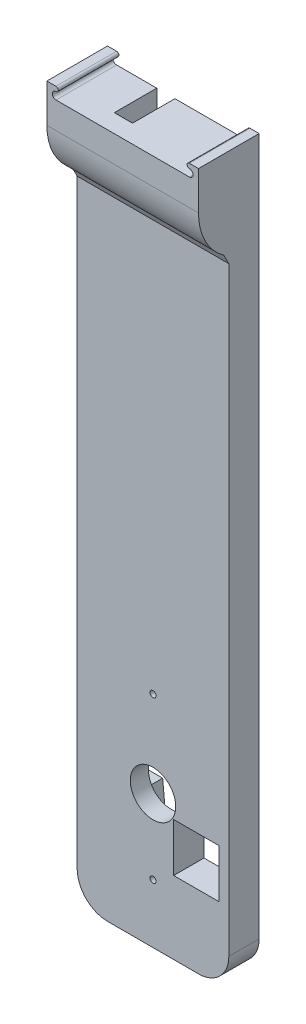
from build123d import *

# Parameters (mm, degrees)
SKICA1_W                 = 25
SKICA1_H                 = 120
P_IDAT_VYSUNUT_M1_DEPTH  = 5
SKICA2_W                 = 25
SKICA2_H                 = 15
P_IDAT_VYSUNUT_M2_DEPTH  = 10
ZAOBLIT5_R               = 5
ZAOBLIT6_R               = 5
ODEBRAT_VYSUNUT_M2_DEPTH = 20
ZAOBLIT7_R               = 10
SKICA4_W                 = 3
SKICA4_H                 = 7
ODEBRAT_VYSUNUT_M3_DEPTH = 4
ODEBRAT_VYSUNUT_M4_DEPTH = 2
ODEBRAT_START            = -3
SKICA7_R                 = 0.5
ODEBRAT_VYSUNUT_M5_DEPTH = 2.8
SKICA8_R                 = 3.75
ODEBRAT_VYSUNUT_M6_DEPTH = 123.837290755
SKICA9_W                 = 7.5
SKICA9_H                 = 8
ODEBRAT_VYSUNUT_M7_DEPTH = 123.983738762


with BuildPart() as part:
    # Skica1 → Přidat vysunutím1 (new body)
    with BuildSketch(Plane.XY):
        with Locations((12.5, 60)):
            Rectangle(SKICA1_W, SKICA1_H)
    extrude(amount=P_IDAT_VYSUNUT_M1_DEPTH)

    # Skica2 → Přidat vysunutím2 (add)
    with BuildSketch(Plane(origin=(0, 0, 0), x_dir=(-1, 0, 0), z_dir=(0, 0, -1))):
        with Locations((-12.5, 112.5)):
            Rectangle(SKICA2_W, SKICA2_H)
    extrude(amount=-P_IDAT_VYSUNUT_M2_DEPTH)

    # Zaoblit5
    zaoblit5_edges = [part.edges().sort_by_distance(p)[0] for p in [
        (25, 0, 2.5),
    ]]
    fillet(zaoblit5_edges, radius=ZAOBLIT5_R)

    # Zaoblit6
    zaoblit6_edges = [part.edges().sort_by_distance(p)[0] for p in [
        (0, 0, 2.5),
    ]]
    fillet(zaoblit6_edges, radius=ZAOBLIT6_R)

    # Skica3 → Odebrat vysunutím2 (cut)
    with BuildSketch(Plane.XY.offset(10)):
        with BuildLine():
            Line((1.5, 118.04), (23.5, 118.04))
            ThreePointArc((23.5, 118.04), (24.1, 118.64), (23.5, 119.24))
            ThreePointArc((23.5, 119.24), (23.12, 119.62), (23.5, 120))
            Line((23.5, 120), (1.5, 120))
            ThreePointArc((1.5, 120), (1.88, 119.62), (1.5, 119.24))
            ThreePointArc((1.5, 119.24), (0.9, 118.64), (1.5, 118.04))
        make_face()
    extrude(amount=-ODEBRAT_VYSUNUT_M2_DEPTH, mode=Mode.SUBTRACT)

    # Zaoblit7
    # the kernel refuses this fillet: 10 mm, written as the material it takes off along each edge
    with BuildSketch(Plane(origin=(-21.650635095, 105, 10), x_dir=(0, 0, -1), z_dir=(1, 0, 0))) as zaoblit7_piece_1:
        with BuildLine():
            CenterArc((10, 8.660254038), ZAOBLIT7_R, 180, 60)
            Line((0, 8.660254038), (-0.2, 8.660254038))
            Line((-0.2, 8.660254038), (-0.2, 0))
            Line((-0.2, 0), (0, -0.2))
            ThreePointArc((0, -0.2), (2.5, -0.2), (4.9, -0.173205081))
            Line((4.9, -0.173205081), (5, 0))
        make_face()
    extrude(amount=68.301270189, mode=Mode.SUBTRACT)

    # Zaoblit8
    # the kernel refuses this chamfer: 2 mm, written as the material it adds along each edge
    with BuildSketch(Plane(origin=(25, 105, 5), x_dir=(0, -0.9995029762160257, -0.031524602064212835), z_dir=(-1, 0, 0))) as zaoblit8_piece_1:
        with BuildLine():
            Line((1.15829653, 0), (-0.636224816, 0.850214013))
            Line((-0.636224816, 0.850214013), (-0.667962409, 0.825868064))
            ThreePointArc((-0.667962409, 0.825868064), (-0.324476703, 0.420675743), (-0.033993307, -0.021082104))
            Line((-0.033993307, -0.021082104), (0.001260984, -0.039980119))
            ThreePointArc((0.001260984, -0.039980119), (0.579833691, -0.021731775), (1.159557514, -0.039980119))
            Line((1.159557514, -0.039980119), (1.15829653, 0))
        make_face()
    extrude(amount=25)

    # Skica4 → Odebrat vysunutím3 (cut)
    with BuildSketch(Plane(origin=(0, 118.04, 0), x_dir=(1, 0, 0), z_dir=(0, 1, 0))):
        with Locations((9.62, -3.5)):
            Rectangle(SKICA4_W, SKICA4_H)
    extrude(amount=-ODEBRAT_VYSUNUT_M3_DEPTH, mode=Mode.SUBTRACT)

    # Skica5 → Odebrat vysunutím4 (cut)
    with BuildSketch(Plane.XY):
        Polygon((11, 43), (9.272727273, 24), (15.727272727, 24), (14, 43), align=None)
        with BuildLine():
            Line((5.5, 24), (5.5, 20))
            ThreePointArc((5.5, 20), (3.5, 22), (5.5, 24))
        make_face()
        Polygon((9.09375, 20), (9, 21), (9.272727273, 24), (5.5, 24), (5.5, 20), align=None)
        Polygon((9.272727273, 24), (9, 21), (16, 21), (15.727272727, 24), align=None)
        Polygon((16, 21), (9, 21), (9.09375, 20), (15.90625, 20), align=None)
        Polygon((15.727272727, 24), (16, 21), (15.90625, 20), (19.5, 20), (19.5, 24), align=None)
        with BuildLine():
            ThreePointArc((19.5, 24), (21.5, 22), (19.5, 20))
            Line((19.5, 20), (19.5, 24))
        make_face()
        Polygon((15.90625, 20), (9.09375, 20), (10.5, 5), (14.5, 5), align=None)
    extrude(amount=ODEBRAT_VYSUNUT_M4_DEPTH, mode=Mode.SUBTRACT)

    # Skica7 → Odebrat vysunutím5 (cut)
    with BuildSketch(Plane(origin=(0, 0, 2), x_dir=(-1, 0, 0), z_dir=(0, 0, -1)).offset(ODEBRAT_START)):
        with Locations(Location((-12.5, 36.2, 0), (0, 0, 180))):
            Circle(SKICA7_R)
        with Locations(Location((-12.5, 9.7, 0), (0, 0, 180))):
            Circle(SKICA7_R)
    extrude(amount=ODEBRAT_VYSUNUT_M5_DEPTH, mode=Mode.SUBTRACT)

    # Skica8 → Odebrat vysunutím6 (cut, through all)
    with BuildSketch(Plane(origin=(0, 0, 2), x_dir=(-1, 0, 0), z_dir=(0, 0, -1))):
        with Locations((-12.5, 22)):
            Circle(SKICA8_R)
    extrude(amount=-ODEBRAT_VYSUNUT_M6_DEPTH, mode=Mode.SUBTRACT)

    # Skica9 → Odebrat vysunutím7 (cut, through all)
    with BuildSketch(Plane(origin=(0, 0, 0), x_dir=(-1, 0, 0), z_dir=(0, 0, -1))):
        with Locations((-19.65625, 16)):
            Rectangle(SKICA9_W, SKICA9_H)
    extrude(amount=-ODEBRAT_VYSUNUT_M7_DEPTH, mode=Mode.SUBTRACT)


solid = part.part
